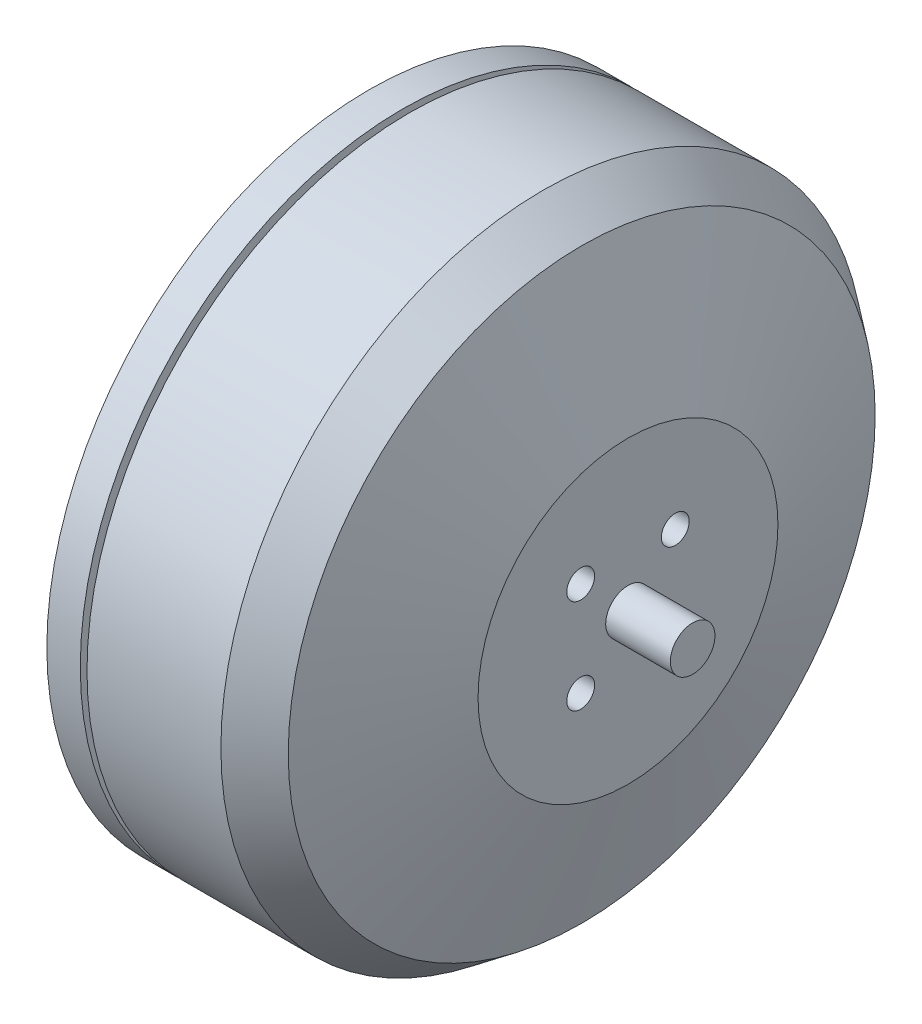
from build123d import *

# Parameters (mm, degrees)
TROU_POUR_TARAUDAGE_POUR_TROU_TARAUD_M3_D     = 2.5
TROU_POUR_TARAUDAGE_POUR_TROU_TARAUD_M3_DEPTH = 3.6
TROU_POUR_TARAUDAGE_POUR_TROU_TARAUD_M3_TIP   = 0.751075774
TROU_POUR_TARAUDAGE_POUR_TROU_TARAUD_2_D      = 2.5
TROU_POUR_TARAUDAGE_POUR_TROU_TARAUD_2_DEPTH  = 6
TROU_POUR_TARAUDAGE_POUR_TROU_TARAUD_2_TIP    = 0.751075774
BOSS_EXTRU_1_START                            = -19.5
ESQUISSE6_R                                   = 1.15
BOSS_EXTRU_1_DEPTH                            = 15
R_P_TITION_LIN_AIRE1_COUNT                    = 2
R_P_TITION_LIN_AIRE1_PITCH                    = 3
R_P_TITION_LIN_AIRE1_COUNT_DIR2               = 2
R_P_TITION_LIN_AIRE1_PITCH_DIR2               = 3


# Read off the part's stored shape, not the designer's step: Révolution1
with BuildPart() as part:
    # Révolution1 outline → Révolution1 (revolve)
    with BuildSketch(Plane.YX):
        Polygon((0, 36.1), (0, 0), (4.25, 0), (4.25, 4.8), (7.35, 4.8), (8.75, 2.3), (17.75, 2.3), (28.9, 7.079588628), (28.9, 10.079588628), (24.426597876, 10.079588628), (24.426597876, 10.679588628), (28.9, 10.679588628), (28.9, 22.688797149), (26.318773317, 26.149098698), (13.448864835, 30.3), (2, 30.3), (2, 36.1), align=None)
    revolve(axis=Axis((0, 0, 0), (1, 0, 0)))

    # Trou pour taraudage pour trou taraud_ M3
    with Locations(Plane.ZY.offset(-2.3)):
        with Locations((-8.838834765, 8.838834765), (8.838834765, -8.838834765), (-8.838834765, -8.838834765), (8.838834765, 8.838834765)):
            Hole(TROU_POUR_TARAUDAGE_POUR_TROU_TARAUD_M3_D / 2, depth=TROU_POUR_TARAUDAGE_POUR_TROU_TARAUD_M3_DEPTH)
            with Locations((0, 0, -(TROU_POUR_TARAUDAGE_POUR_TROU_TARAUD_M3_DEPTH + TROU_POUR_TARAUDAGE_POUR_TROU_TARAUD_M3_TIP / 2))):  # 118° drill point
                Cone(0, TROU_POUR_TARAUDAGE_POUR_TROU_TARAUD_M3_D / 2, TROU_POUR_TARAUDAGE_POUR_TROU_TARAUD_M3_TIP, mode=Mode.SUBTRACT)

    # Trou pour taraudage pour trou taraud 2
    with Locations(Plane(origin=(30.3, 0, 0), x_dir=(0, 0, -1), z_dir=(1, 0, 0))):
        with Locations((-4.242640687, 4.242640687), (4.242640687, -4.242640687), (-4.242640687, -4.242640687), (4.242640687, 4.242640687)):
            Hole(TROU_POUR_TARAUDAGE_POUR_TROU_TARAUD_2_D / 2, depth=TROU_POUR_TARAUDAGE_POUR_TROU_TARAUD_2_DEPTH)
            with Locations((0, 0, -(TROU_POUR_TARAUDAGE_POUR_TROU_TARAUD_2_DEPTH + TROU_POUR_TARAUDAGE_POUR_TROU_TARAUD_2_TIP / 2))):  # 118° drill point
                Cone(0, TROU_POUR_TARAUDAGE_POUR_TROU_TARAUD_2_D / 2, TROU_POUR_TARAUDAGE_POUR_TROU_TARAUD_2_TIP, mode=Mode.SUBTRACT)


with BuildPart() as body_2:
    # Esquisse6 → Boss.-Extru.1 (new body)
    with BuildSketch(Plane(origin=(0, 0, 0), x_dir=(1, 0, 0), z_dir=(0, 1, 0)).offset(BOSS_EXTRU_1_START)):
        with Locations(Location((3.214052754, 0, 0), (0, 0, 270))):
            Circle(ESQUISSE6_R)
    boss_extru_1 = extrude(amount=-BOSS_EXTRU_1_DEPTH)


with BuildPart() as r_p_tition_lin_aire1_1:
    # Répétition linéaire1: Boss.-Extru.1 2 × 2
    with Locations(*[Vector(0, 0, 1) * (i * R_P_TITION_LIN_AIRE1_PITCH) + Vector(0, 0, -1) * (j * R_P_TITION_LIN_AIRE1_PITCH_DIR2) for i in range(R_P_TITION_LIN_AIRE1_COUNT) for j in range(R_P_TITION_LIN_AIRE1_COUNT_DIR2) if (i, j) != (0, 0)]):
        add(boss_extru_1)


solid = Compound([part.part, body_2.part, r_p_tition_lin_aire1_1.part])
